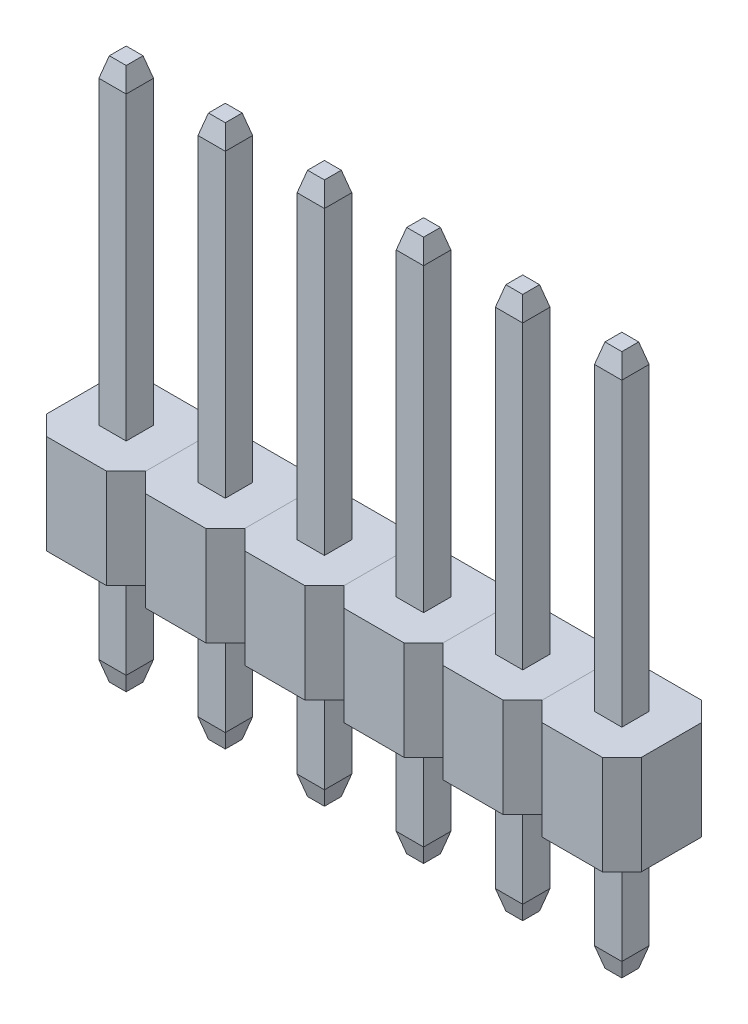
from build123d import *

# Parameters (mm, degrees)
SKETCH3_W           = 2.54
SKETCH3_H           = 2.54
SKETCH3_W_2         = 0.635
SKETCH3_H_2         = 0.635
BOSS_EXTRUDE1_DEPTH = 1.27
CHAMFER1_SIZE       = 0.5
BOSS_EXTRUDE2_START = -5.2
SKETCH5_W           = 0.7
SKETCH5_H           = 0.7
BOSS_EXTRUDE2_DEPTH = 12.9
SKETCH6_W           = 0.7
SKETCH6_H           = 0.7
BOSS_EXTRUDE3_DEPTH = 0.5
BOSS_EXTRUDE3_TAPER = 15
SKETCH7_W           = 0.7
SKETCH7_H           = 0.7
BOSS_EXTRUDE4_DEPTH = 0.5
BOSS_EXTRUDE4_TAPER = 15
LPATTERN1_COUNT     = 6
LPATTERN1_PITCH     = 2.54


with BuildPart() as part:
    # Sketch3 → Boss-Extrude1 (new, symmetric)
    with BuildSketch(Plane(origin=(0, 0, 0), x_dir=(1, 0, 0), z_dir=(0, 1, 0))):
        Rectangle(SKETCH3_W, SKETCH3_H)
        Rectangle(SKETCH3_W_2, SKETCH3_H_2, mode=Mode.SUBTRACT)
    extrude(amount=BOSS_EXTRUDE1_DEPTH, both=True)

    # Chamfer1
    chamfer1_edges = [part.edges().sort_by_distance(p)[0] for p in [
        (-1.27, 0, 1.27),
        (-1.27, 0, -1.27),
        (1.27, 0, -1.27),
        (1.27, 0, 1.27),
    ]]
    chamfer(chamfer1_edges, length=CHAMFER1_SIZE)


with BuildPart() as body_2:
    # Sketch5 → Boss-Extrude2 (new body)
    with BuildSketch(Plane(origin=(0, 1.27, 0), x_dir=(1, 0, 0), z_dir=(0, 1, 0)).offset(BOSS_EXTRUDE2_START)):
        Rectangle(SKETCH5_W, SKETCH5_H)
    extrude(amount=BOSS_EXTRUDE2_DEPTH)

    # Sketch6 → Boss-Extrude3 (add)
    with BuildSketch(Plane(origin=(0, 8.97, 0), x_dir=(1, 0, 0), z_dir=(0, 1, 0))):
        Rectangle(SKETCH6_W, SKETCH6_H)
    extrude(amount=BOSS_EXTRUDE3_DEPTH, taper=BOSS_EXTRUDE3_TAPER)

    # Sketch7 → Boss-Extrude4 (add)
    with BuildSketch(Plane.XZ.offset(3.93)):
        Rectangle(SKETCH7_W, SKETCH7_H)
    extrude(amount=BOSS_EXTRUDE4_DEPTH, taper=BOSS_EXTRUDE4_TAPER)


with BuildPart() as lpattern1_1:
    # LPattern1: pattern copy
    add(body_2.part.moved(Location(Vector(1, 0, 0) * (1 * LPATTERN1_PITCH))))


with BuildPart() as lpattern1_2:
    # LPattern1: pattern copy
    add(body_2.part.moved(Location(Vector(1, 0, 0) * (2 * LPATTERN1_PITCH))))


with BuildPart() as lpattern1_3:
    # LPattern1: pattern copy
    add(body_2.part.moved(Location(Vector(1, 0, 0) * (3 * LPATTERN1_PITCH))))


with BuildPart() as lpattern1_4:
    # LPattern1: pattern copy
    add(body_2.part.moved(Location(Vector(1, 0, 0) * (4 * LPATTERN1_PITCH))))


with BuildPart() as lpattern1_5:
    # LPattern1: pattern copy
    add(body_2.part.moved(Location(Vector(1, 0, 0) * (5 * LPATTERN1_PITCH))))


with BuildPart() as lpattern1_6:
    # LPattern1: pattern copy
    add(part.part.moved(Location(Vector(1, 0, 0) * (1 * LPATTERN1_PITCH))))


with BuildPart() as lpattern1_7:
    # LPattern1: pattern copy
    add(part.part.moved(Location(Vector(1, 0, 0) * (2 * LPATTERN1_PITCH))))


with BuildPart() as lpattern1_8:
    # LPattern1: pattern copy
    add(part.part.moved(Location(Vector(1, 0, 0) * (3 * LPATTERN1_PITCH))))


with BuildPart() as lpattern1_9:
    # LPattern1: pattern copy
    add(part.part.moved(Location(Vector(1, 0, 0) * (4 * LPATTERN1_PITCH))))


with BuildPart() as lpattern1_10:
    # LPattern1: pattern copy
    add(part.part.moved(Location(Vector(1, 0, 0) * (5 * LPATTERN1_PITCH))))


solid = Compound([part.part, body_2.part, lpattern1_1.part, lpattern1_2.part, lpattern1_3.part, lpattern1_4.part, lpattern1_5.part, lpattern1_6.part, lpattern1_7.part, lpattern1_8.part, lpattern1_9.part, lpattern1_10.part])
